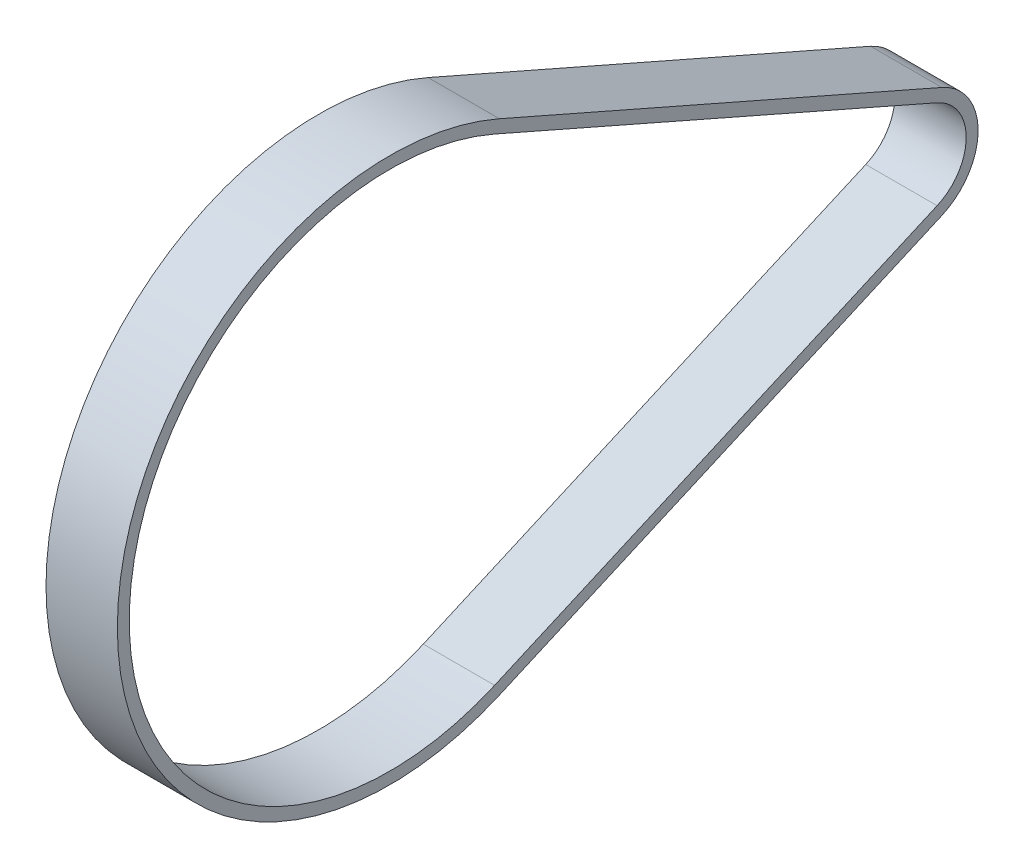
from build123d import *

# Parameters (mm, degrees)
BOSS_EXTRUDE1_DEPTH = 7.5


with BuildPart() as part:
    # Sketch1 → Boss-Extrude1 (new, symmetric)
    with BuildSketch(Plane(origin=(0, 0, 0), x_dir=(0, 0, -1), z_dir=(1, 0, 0))):
        with BuildLine():
            Line((-32.441820734, 52.468422348), (60.576065008, 11.659649411))
            ThreePointArc((60.576065008, 11.659649411), (68.193143314, 0), (60.576065008, -11.659649411))
            Line((60.576065008, -11.659649411), (-32.441820734, -52.468422348))
            ThreePointArc((-32.441820734, -52.468422348), (-112.75652738, 0), (-32.441820734, 52.468422348))
        make_face()
        with BuildLine():
            Line((-33.446210906, 50.179055539), (59.571674836, 9.370282602))
            ThreePointArc((59.571674836, 9.370282602), (65.693143314, 0), (59.571674836, -9.370282602))
            Line((59.571674836, -9.370282602), (-33.446210906, -50.179055539))
            ThreePointArc((-33.446210906, -50.179055539), (-110.25652738, 0), (-33.446210906, 50.179055539))
        make_face(mode=Mode.SUBTRACT)
    extrude(amount=BOSS_EXTRUDE1_DEPTH, both=True)


solid = part.part
